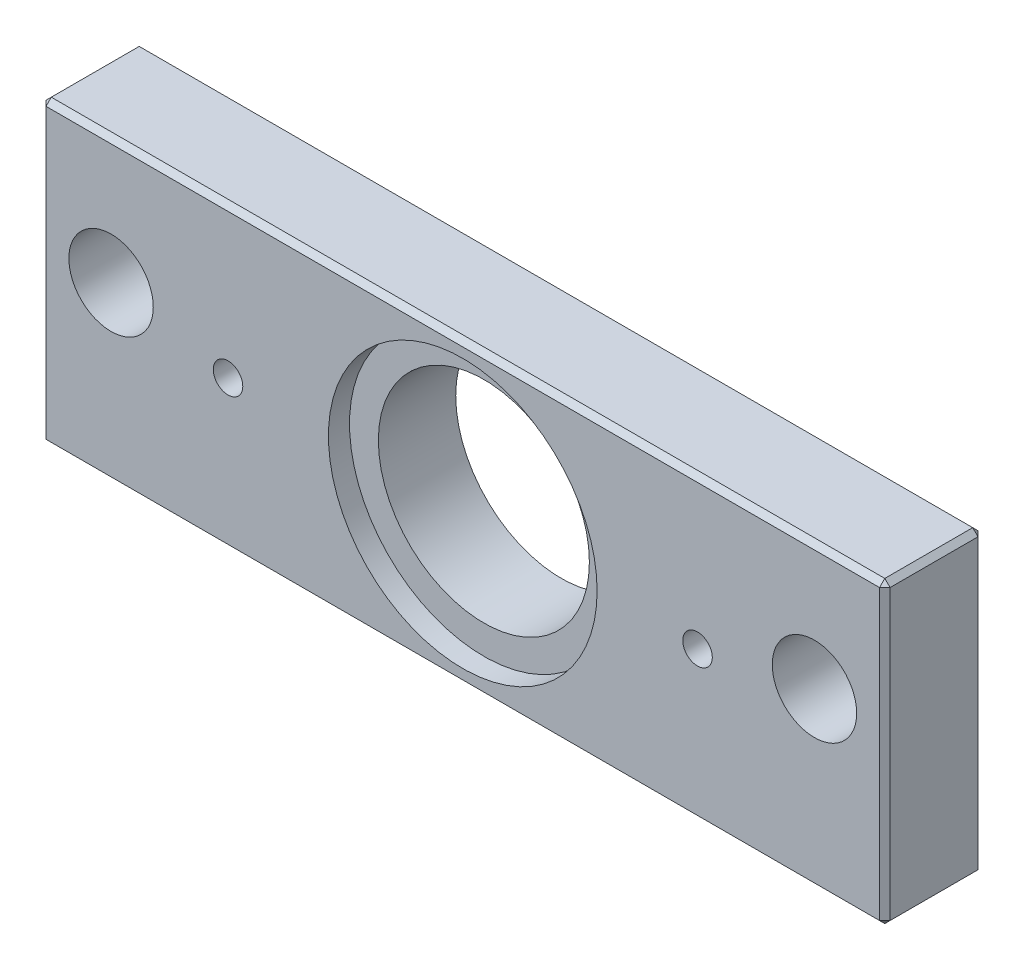
from build123d import *

# Parameters (mm, degrees)
SKETCH1_W           = 120
SKETCH1_H           = 42.5
BOSS_EXTRUDE1_DEPTH = 7
SKETCH2_R           = 19.1
CUT_EXTRUDE1_DEPTH  = 3
SKETCH3_R           = 15
CUT_EXTRUDE2_DEPTH  = 65.595375221
SKETCH4_R           = 2.1
CUT_EXTRUDE3_DEPTH  = 66.173326599
SKETCH5_R           = 6
CUT_EXTRUDE4_DEPTH  = 66.173326599
SKETCH6_R           = 2.1
SKETCH6_R_2         = 1.25
CUT_EXTRUDE5_DEPTH  = 10
CHAMFER1_SIZE       = 0.75


with BuildPart() as part:
    # Sketch1 → Boss-Extrude1 (new, symmetric)
    with BuildSketch(Plane.XY):
        Rectangle(SKETCH1_W, SKETCH1_H)
    extrude(amount=BOSS_EXTRUDE1_DEPTH, both=True)

    # Sketch2 → Cut-Extrude1 (cut)
    with BuildSketch(Plane.XY.offset(7)):
        Circle(SKETCH2_R)
    extrude(amount=-CUT_EXTRUDE1_DEPTH, mode=Mode.SUBTRACT)

    # Sketch3 → Cut-Extrude2 (cut, through all)
    with BuildSketch(Plane.XY.offset(4)):
        Circle(SKETCH3_R)
    extrude(amount=-CUT_EXTRUDE2_DEPTH, mode=Mode.SUBTRACT)

    # Sketch4 → Cut-Extrude3 (cut, through all)
    with BuildSketch(Plane.XY.offset(7)):
        with Locations((-33.375, 0)):
            Circle(SKETCH4_R)
        with Locations((33.375, 0)):
            Circle(SKETCH4_R)
    extrude(amount=-CUT_EXTRUDE3_DEPTH, mode=Mode.SUBTRACT)

    # Sketch5 → Cut-Extrude4 (cut, through all)
    with BuildSketch(Plane.XY.offset(7)):
        with Locations((-50, 3.4)):
            Circle(SKETCH5_R)
        with Locations((50, 3.4)):
            Circle(SKETCH5_R)
    extrude(amount=-CUT_EXTRUDE4_DEPTH, mode=Mode.SUBTRACT)

    # Sketch6 → Cut-Extrude5 (cut)
    with BuildSketch(Plane.XZ.offset(21.25)):
        with Locations((-50, 0)):
            Circle(SKETCH6_R)
        with Locations((-25, 0)):
            Circle(SKETCH6_R)
        with Locations((25, 0)):
            Circle(SKETCH6_R)
        with Locations((50, 0)):
            Circle(SKETCH6_R)
        with Locations((-37.5, 0)):
            Circle(SKETCH6_R_2)
        with Locations((37.5, 0)):
            Circle(SKETCH6_R_2)
    extrude(amount=-CUT_EXTRUDE5_DEPTH, mode=Mode.SUBTRACT)

    # Chamfer1
    chamfer1_edges = [part.edges().sort_by_distance(p)[0] for p in [
        (60, -21.25, 0),
        (60, 0, -7),
        (60, 21.25, 0),
        (0, -21.25, -7),
        (-60, -21.25, 0),
        (-60, 0, -7),
        (0, 21.25, -7),
        (-60, 21.25, 0),
        (60, 0, 7),
        (0, -21.25, 7),
        (-60, 0, 7),
        (0, 21.25, 7),
    ]]
    chamfer(chamfer1_edges, length=CHAMFER1_SIZE)


solid = part.part
